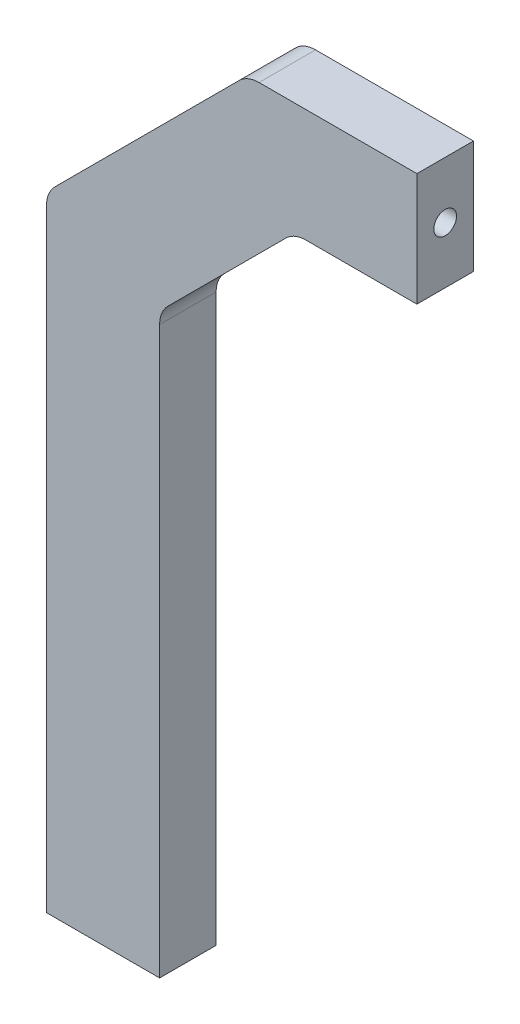
from build123d import *

# Parameters (mm, degrees)
BOSS_EXTRUDE1_DEPTH             = 6.35
FILLET1_R                       = 6.35
TAP_DRILL_FOR_1_4_20_TAP1_D     = 5.1054
TAP_DRILL_FOR_1_4_20_TAP1_DEPTH = 12.7
TAP_DRILL_FOR_1_4_20_TAP1_TIP   = 1.533816902
TAP_DRILL_FOR_1_4_20_TAP2_D     = 5.1054
TAP_DRILL_FOR_1_4_20_TAP2_DEPTH = 12.7
TAP_DRILL_FOR_1_4_20_TAP2_TIP   = 1.533816902


with BuildPart() as part:
    # Sketch1 → Boss-Extrude1 (new, symmetric)
    with BuildSketch(Plane.XY):
        Polygon((0, 12.7), (0, -12.7), (-27.578975516, -12.7), (-57.8104, -42.931424484), (-57.8104, -172.72), (-83.2104, -172.72), (-83.2104, -32.4104), (-38.1, 12.7), align=None)
    extrude(amount=BOSS_EXTRUDE1_DEPTH, both=True)

    # Fillet1
    fillet1_edges = [part.edges().sort_by_distance(p)[0] for p in [
        (-27.578975516, -12.7, 0),
        (-57.8104, -42.931424484, 0),
        (-38.1, 12.7, 0),
        (-83.2104, -32.4104, 0),
    ]]
    fillet(fillet1_edges, radius=FILLET1_R)

    # Tap Drill for 1/4-20 Tap1
    with Locations(Plane(origin=(0, 0, 0), x_dir=(0, 0, -1), z_dir=(1, 0, 0))):
        with Locations((0, 0)):
            Hole(TAP_DRILL_FOR_1_4_20_TAP1_D / 2, depth=TAP_DRILL_FOR_1_4_20_TAP1_DEPTH)
            with Locations((0, 0, -(TAP_DRILL_FOR_1_4_20_TAP1_DEPTH + TAP_DRILL_FOR_1_4_20_TAP1_TIP / 2))):  # 118° drill point
                Cone(0, TAP_DRILL_FOR_1_4_20_TAP1_D / 2, TAP_DRILL_FOR_1_4_20_TAP1_TIP, mode=Mode.SUBTRACT)

    # Tap Drill for 1/4-20 Tap2
    with Locations(Plane(origin=(0, -172.72, 0), x_dir=(-1, 0, 0), z_dir=(0, -1, 0))):
        with Locations((70.5104, 0)):
            Hole(TAP_DRILL_FOR_1_4_20_TAP2_D / 2, depth=TAP_DRILL_FOR_1_4_20_TAP2_DEPTH)
            with Locations((0, 0, -(TAP_DRILL_FOR_1_4_20_TAP2_DEPTH + TAP_DRILL_FOR_1_4_20_TAP2_TIP / 2))):  # 118° drill point
                Cone(0, TAP_DRILL_FOR_1_4_20_TAP2_D / 2, TAP_DRILL_FOR_1_4_20_TAP2_TIP, mode=Mode.SUBTRACT)


solid = part.part
